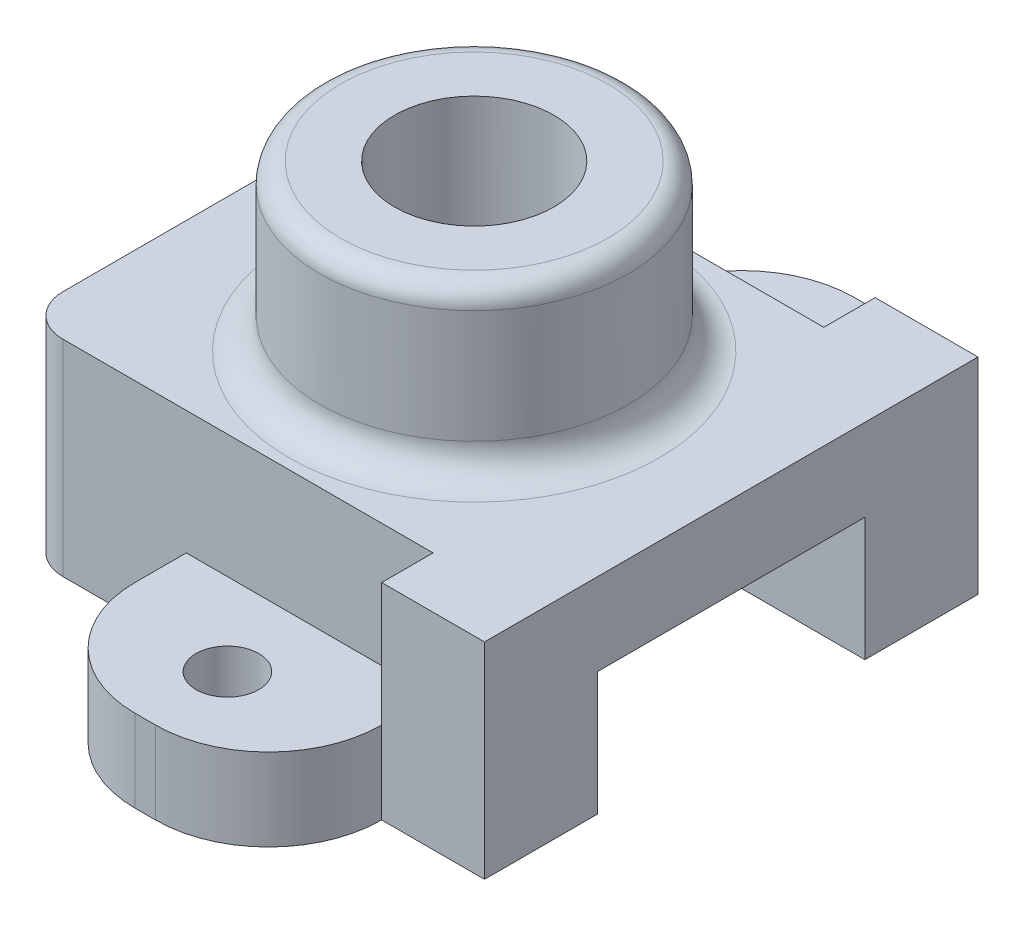
from build123d import *

# Parameters (mm, degrees)
SKETCH1_W           = 22
SKETCH1_H           = 13
BOSS_EXTRUDE1_DEPTH = 6
BOSS_EXTRUDE2_DEPTH = 2
BOSS_EXTRUDE3_DEPTH = 8
SKETCH4_R           = 1.525
SKETCH4_R_2         = 1.524
CUT_EXTRUDE1_DEPTH  = 36.566838488
SKETCH5_W           = 9
SKETCH5_H           = 4.088652256
CUT_EXTRUDE2_DEPTH  = 38.735924528
FILLET1_R           = 2
SKETCH6_W           = 12
SKETCH6_H           = 13.009000019
SKETCH6_W_2         = 15.838286437
CUT_EXTRUDE3_DEPTH  = 4
SKETCH7_W           = 2.5
SKETCH7_H           = 8
BOSS_EXTRUDE5_DEPTH = 3
FILLET3_R           = 2.5
FILLET4_R           = 2.5
SKETCH9_W           = 24
SKETCH9_H           = 8
CUT_EXTRUDE5_DEPTH  = 3
BOSS_EXTRUDE6_REACH = 35.526
SKETCH10_W          = 5
SKETCH10_H          = 2.5
BOSS_EXTRUDE7_DEPTH = 2
SKETCH12_R          = 7.5
BOSS_EXTRUDE8_DEPTH = 8
SKETCH13_R          = 3.8735
CUT_EXTRUDE6_DEPTH  = 8
FILLET5_R           = 1.5
FILLET7_R           = 1


with BuildPart() as part:
    # Sketch1 → Boss-Extrude1 (new body)
    with BuildSketch(Plane(origin=(0, 0, 0), x_dir=(1, 0, 0), z_dir=(0, 1, 0))):
        with BuildLine():
            Line((-1, -3), (23, -3))
            Line((23, -3), (25, -3))
            Line((25, -3), (25, -1))
            Line((25, -1), (25, 14))
            Line((25, 14), (25, 16))
            Line((25, 16), (23, 16))
            Line((23, 16), (-1, 16))
            ThreePointArc((-1, 16), (-2.414213562, 15.414213562), (-3, 14))
            Line((-3, 14), (-3, -1))
            ThreePointArc((-3, -1), (-2.414213562, -2.414213562), (-1, -3))
        make_face()
        with Locations((11, 6.5)):
            Rectangle(SKETCH1_W, SKETCH1_H, mode=Mode.SUBTRACT)
    extrude(amount=BOSS_EXTRUDE1_DEPTH)

    # Sketch2 → Boss-Extrude2 (add)
    with BuildSketch(Plane(origin=(0, 6, 0), x_dir=(1, 0, 0), z_dir=(0, 1, 0))):
        with BuildLine():
            Line((25, 14), (25, -1))
            Line((25, -1), (25, -3))
            Line((25, -3), (23, -3))
            Line((23, -3), (-1, -3))
            ThreePointArc((-1, -3), (-2.414213562, -2.414213562), (-3, -1))
            Line((-3, -1), (-3, 14))
            ThreePointArc((-3, 14), (-2.414213562, 15.414213562), (-1, 16))
            Line((-1, 16), (23, 16))
            Line((23, 16), (25, 16))
            Line((25, 16), (25, 14))
        make_face()
    extrude(amount=BOSS_EXTRUDE2_DEPTH)

    # Sketch3 → Boss-Extrude3 (add)
    with BuildSketch(Plane.XZ):
        with BuildLine():
            Line((5, 3), (17, 3))
            Line((17, 3), (17, 5.5))
            ThreePointArc((17, 5.5), (15.389087297, 9.389087297), (11.5, 11))
            Line((11.5, 11), (10.5, 11))
            ThreePointArc((10.5, 11), (6.610912703, 9.389087297), (5, 5.5))
            Line((5, 5.5), (5, 3))
        make_face()
        with BuildLine():
            Line((17, -16), (5, -16))
            Line((5, -16), (5, -18.5))
            ThreePointArc((5, -18.5), (6.610912703, -22.389087297), (10.5, -24))
            Line((10.5, -24), (11.5, -24))
            ThreePointArc((11.5, -24), (15.389087297, -22.389087297), (17, -18.5))
            Line((17, -18.5), (17, -16))
        make_face()
    extrude(amount=-BOSS_EXTRUDE3_DEPTH)

    # Sketch4 → Cut-Extrude1 (cut, through all)
    with BuildSketch(Plane(origin=(0, 0, 0), x_dir=(-1, 0, 0), z_dir=(0, -1, 0))):
        with Locations(Location((-11, 20, 0), (0, 0, 90))):
            Circle(SKETCH4_R)
        with Locations(Location((-11, -7, 0), (0, 0, 90))):
            Circle(SKETCH4_R_2)
    extrude(amount=-CUT_EXTRUDE1_DEPTH, mode=Mode.SUBTRACT)

    # Sketch5 → Cut-Extrude2 (cut, through all)
    with BuildSketch(Plane(origin=(25, 0, 0), x_dir=(0, 0, -1), z_dir=(1, 0, 0))):
        with Locations((6.5, 2.044326128)):
            Rectangle(SKETCH5_W, SKETCH5_H)
    extrude(amount=-CUT_EXTRUDE2_DEPTH, mode=Mode.SUBTRACT)

    # Fillet1
    fillet1_edges = [part.edges().sort_by_distance(p)[0] for p in [
        (-1.5, 4.088652256, -11),
        (-1.5, 4.088652256, -2),
        (23.5, 4.088652256, -11),
        (23.5, 4.088652256, -2),
    ]]
    fillet(fillet1_edges, radius=FILLET1_R)

    # Sketch6 → Cut-Extrude3 (cut)
    with BuildSketch(Plane(origin=(0, 8, 0), x_dir=(1, 0, 0), z_dir=(0, 1, 0))):
        with Locations((11, 22.504500009)):
            Rectangle(SKETCH6_W, SKETCH6_H)
        with Locations((11.149066226, -9.50450001)):
            Rectangle(SKETCH6_W_2, SKETCH6_H)
    extrude(amount=-CUT_EXTRUDE3_DEPTH, mode=Mode.SUBTRACT)

    # Sketch7 → Boss-Extrude5 (add)
    with BuildSketch(Plane(origin=(25, 0, 0), x_dir=(0, 0, -1), z_dir=(1, 0, 0))):
        with Locations((17.25, 4)):
            Rectangle(SKETCH7_W, SKETCH7_H)
        with Locations((-4.25, 4)):
            Rectangle(SKETCH7_W, SKETCH7_H)
    extrude(amount=-BOSS_EXTRUDE5_DEPTH)

    # Fillet3
    fillet3_edges = [part.edges().sort_by_distance(p)[0] for p in [
        (22, 4, -16),
    ]]
    fillet(fillet3_edges, radius=FILLET3_R - 0.0001)  # a hair under: the kernel refuses the full size

    # Fillet4
    fillet4_edges = [part.edges().sort_by_distance(p)[0] for p in [
        (22, 4, 3),
    ]]
    fillet(fillet4_edges, radius=FILLET4_R - 0.0001)  # a hair under: the kernel refuses the full size

    # Sketch9 → Cut-Extrude5 (cut)
    with BuildSketch(Plane(origin=(25, 0, 0), x_dir=(0, 0, -1), z_dir=(1, 0, 0))):
        with Locations((6.5, 4)):
            Rectangle(SKETCH9_W, SKETCH9_H)
    extrude(amount=-CUT_EXTRUDE5_DEPTH, mode=Mode.SUBTRACT)

    # Boss-Extrude6: up to this face of the body (flat: up to its plane)
    boss_extrude6_end = Plane(part.part.faces().sort_by_distance((9.97036164, 0, 3.836684907))[0])
    # Sketch10 → Boss-Extrude6 (add, up to the picked face)
    with BuildSketch(Plane(origin=(0, 8, 0), x_dir=(1, 0, 0), z_dir=(0, 1, 0)), mode=Mode.PRIVATE) as boss_extrude6_sk1:
        with Locations((19.5, 17.25)):
            Rectangle(SKETCH10_W, SKETCH10_H)
    boss_extrude6_tool1 = split(extrude(boss_extrude6_sk1.sketch, amount=-BOSS_EXTRUDE6_REACH, mode=Mode.PRIVATE), bisect_by=boss_extrude6_end, keep=Keep.BOTH, mode=Mode.PRIVATE)
    # Sketch10 → Boss-Extrude6 (add, up to the picked face)
    with BuildSketch(Plane(origin=(0, 8, 0), x_dir=(1, 0, 0), z_dir=(0, 1, 0)), mode=Mode.PRIVATE) as boss_extrude6_sk2:
        with Locations((19.5, -4.25)):
            Rectangle(SKETCH10_W, SKETCH10_H)
    boss_extrude6_tool2 = split(extrude(boss_extrude6_sk2.sketch, amount=-BOSS_EXTRUDE6_REACH, mode=Mode.PRIVATE), bisect_by=boss_extrude6_end, keep=Keep.BOTH, mode=Mode.PRIVATE)
    add(boss_extrude6_tool1.solids().sort_by(Axis((19.5, 8, -17.25), (0, -1, 0)))[0])
    add(boss_extrude6_tool2.solids().sort_by(Axis((19.5, 8, 4.25), (0, -1, 0)))[0])

    # Sketch11 → Boss-Extrude7 (add)
    with BuildSketch(Plane(origin=(0, 8, 0), x_dir=(1, 0, 0), z_dir=(0, 1, 0))):
        with BuildLine():
            Line((17, -3), (-1, -3))
            ThreePointArc((-1, -3), (-2.414213562, -2.414213562), (-3, -1))
            Line((-3, -1), (-3, 14))
            ThreePointArc((-3, 14), (-2.414213562, 15.414213562), (-1, 16))
            Line((-1, 16), (17, 16))
            Line((17, 16), (17, 18.5))
            Line((17, 18.5), (22, 18.5))
            Line((22, 18.5), (22, -5.5))
            Line((22, -5.5), (17, -5.5))
            Line((17, -5.5), (17, -3))
        make_face()
    extrude(amount=BOSS_EXTRUDE7_DEPTH)

    # Sketch12 → Boss-Extrude8 (add)
    with BuildSketch(Plane(origin=(0, 10, 0), x_dir=(1, 0, 0), z_dir=(0, 1, 0))):
        with Locations(Location((9.5, 6.5, 0), (0, 0, 90))):
            Circle(SKETCH12_R)
    extrude(amount=BOSS_EXTRUDE8_DEPTH)

    # Sketch13 → Cut-Extrude6 (cut)
    with BuildSketch(Plane(origin=(0, 18, 0), x_dir=(1, 0, 0), z_dir=(0, 1, 0))):
        with Locations(Location((9.5, 6.5, 0), (0, 0, 270))):
            Circle(SKETCH13_R)
    extrude(amount=-CUT_EXTRUDE6_DEPTH, mode=Mode.SUBTRACT)

    # Fillet5
    fillet5_edges = [part.edges().sort_by_distance(p)[0] for p in [
        (9.5, 10, 1),
    ]]
    fillet(fillet5_edges, radius=FILLET5_R)

    # Fillet7
    fillet7_edges = [part.edges().sort_by_distance(p)[0] for p in [
        (9.5, 18, 1),
    ]]
    fillet(fillet7_edges, radius=FILLET7_R)


solid = part.part
